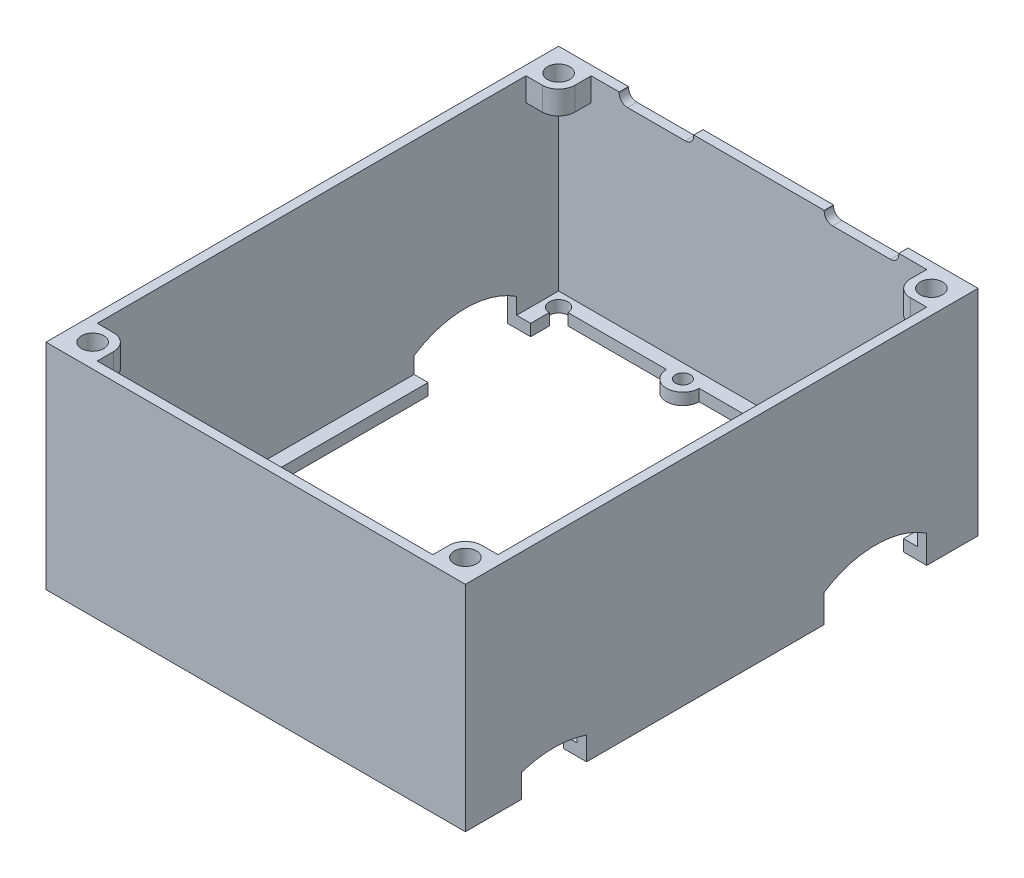
from build123d import *

# Parameters (mm, degrees)
SKETCH1_W               = 90
SKETCH1_H               = 110
BOSS_EXTRUDE1_DEPTH     = 2.5
CUT_EXTRUDE1_DEPTH      = 72.107313267
SKETCH6_R               = 1.6
CUT_EXTRUDE4_DEPTH      = 72.107313267
SKETCH3_W               = 90
SKETCH3_H               = 110
SKETCH3_W_2             = 86
SKETCH3_H_2             = 106
BOSS_EXTRUDE2_DEPTH     = 43.5
SKETCH4_W               = 7
SKETCH4_H               = 7
BOSS_EXTRUDE3_DEPTH     = 5
CUT_EXTRUDE3_REACH      = 86.652
SKETCH5_R               = 2.4
MIRROR2_COPY_1_SKETCH_W = 7
MIRROR2_COPY_1_SKETCH_H = 7
MIRROR2_COPY_1_DEPTH    = 5
MIRROR2_COPY_2_REACH    = 86.652
MIRROR2_COPY_2_SKETCH_R = 2.4
SKETCH8_R               = 3
CUT_EXTRUDE5_DEPTH      = 10
CUT_EXTRUDE6_DEPTH      = 116.06954419
CUT_EXTRUDE7_REACH      = 129.44
SKETCH12_R              = 2
CUT_EXTRUDE8_DEPTH      = 5
CHAMFER1_SIZE           = 0.6
CHAMFER1_SIZE_2         = 1.039230485
FILLET1_R               = 3.5


with BuildPart() as part:
    # Sketch1 → Boss-Extrude1 (new body)
    with BuildSketch(Plane(origin=(0, 0, 0), x_dir=(1, 0, 0), z_dir=(0, 1, 0))):
        Rectangle(SKETCH1_W, SKETCH1_H)
    extrude(amount=BOSS_EXTRUDE1_DEPTH)

    # Sketch2 → Cut-Extrude1 (cut, through all)
    with BuildSketch(Plane(origin=(0, 2.5, 0), x_dir=(1, 0, 0), z_dir=(0, 1, 0))):
        with BuildLine():
            Line((-40, 50), (-16.83333333, 50))
            ThreePointArc((-16.83333333, 50), (-13.33333333, 46.5), (-9.83333333, 50))
            Line((-9.83333333, 50), (23.5, 50))
            ThreePointArc((23.5, 50), (27, 46.5), (30.5, 50))
            Line((30.5, 50), (40, 50))
            Line((40, 50), (40, -50))
            Line((40, -50), (25.6874353, -50))
            ThreePointArc((25.6874353, -50), (22.333333333, -47.5), (18.979231367, -50))
            Line((18.979231367, -50), (-14.8125647, -50))
            ThreePointArc((-14.8125647, -50), (-18.166666667, -47.5), (-21.520768633, -50))
            Line((-21.520768633, -50), (-40, -50))
            Line((-40, -50), (-40, 50))
        make_face()
    extrude(amount=-CUT_EXTRUDE1_DEPTH, mode=Mode.SUBTRACT)

    # Sketch6 → Cut-Extrude4 (cut, through all)
    with BuildSketch(Plane(origin=(0, 2.5, 0), x_dir=(1, 0, 0), z_dir=(0, 1, 0))):
        with Locations(Location((-13.33333333, 50, 0), (0, 0, 270))):
            Circle(SKETCH6_R)
        with Locations(Location((27, 50, 0), (0, 0, 270))):
            Circle(SKETCH6_R)
        with Locations(Location((22.333333333, -51, 0), (0, 0, 270))):
            Circle(SKETCH6_R)
        with Locations(Location((-18.166666667, -51, 0), (0, 0, 270))):
            Circle(SKETCH6_R)
    extrude(amount=-CUT_EXTRUDE4_DEPTH, mode=Mode.SUBTRACT)

    # Sketch3 → Boss-Extrude2 (add)
    with BuildSketch(Plane(origin=(0, 2.5, 0), x_dir=(1, 0, 0), z_dir=(0, 1, 0))):
        Rectangle(SKETCH3_W, SKETCH3_H)
        Rectangle(SKETCH3_W_2, SKETCH3_H_2, mode=Mode.SUBTRACT)
    extrude(amount=BOSS_EXTRUDE2_DEPTH)

    # Sketch4 → Boss-Extrude3 (add)
    with BuildSketch(Plane(origin=(0, 46, 0), x_dir=(1, 0, 0), z_dir=(0, 1, 0))):
        with Locations((-39.5, 49.5)):
            Rectangle(SKETCH4_W, SKETCH4_H)
    boss_extrude3 = extrude(amount=-BOSS_EXTRUDE3_DEPTH)

    # Sketch5 → Cut-Extrude3 (cut, up to next)
    with BuildSketch(Plane(origin=(0, 46, 0), x_dir=(1, 0, 0), z_dir=(0, 1, 0)), mode=Mode.PRIVATE) as cut_extrude3_sk1:
        with Locations(Location((-40, 50, 0), (0, 0, 270))):
            Circle(SKETCH5_R)
    cut_extrude3_tool1 = extrude(cut_extrude3_sk1.sketch, amount=-CUT_EXTRUDE3_REACH, mode=Mode.PRIVATE) & part.part
    cut_extrude3 = cut_extrude3_tool1.solids().sort_by_distance((-40, 46, -50))[0]
    add(cut_extrude3, mode=Mode.SUBTRACT)

    # Mirror1: Boss-Extrude3, Cut-Extrude3 across plane
    add(boss_extrude3.mirror(Plane(origin=(0, 0, 0), x_dir=(0, 0, 1), z_dir=(1, 0, 0))))
    add(cut_extrude3.mirror(Plane(origin=(0, 0, 0), x_dir=(0, 0, 1), z_dir=(1, 0, 0))), mode=Mode.SUBTRACT)

    # Mirror2: Boss-Extrude3, Cut-Extrude3 across plane
    add(boss_extrude3.mirror(Plane.XY))
    add(cut_extrude3.mirror(Plane.XY), mode=Mode.SUBTRACT)

    # Mirror2 copy 1 sketch → Mirror2 copy 1 (add)
    with BuildSketch(Plane(origin=(0, 46, 0), x_dir=(-1, 0, 0), z_dir=(0, 1, 0))):
        with Locations((-39.5, 49.5)):
            Rectangle(MIRROR2_COPY_1_SKETCH_W, MIRROR2_COPY_1_SKETCH_H)
    extrude(amount=-MIRROR2_COPY_1_DEPTH)

    # Mirror2 copy 2 sketch → Mirror2 copy 2 (cut, up to next)
    with BuildSketch(Plane(origin=(0, 46, 0), x_dir=(-1, 0, 0), z_dir=(0, 1, 0)), mode=Mode.PRIVATE) as mirror2_copy_2_sk1:
        with Locations(Location((-40, 50, 0), (0, 0, 270))):
            Circle(MIRROR2_COPY_2_SKETCH_R)
    mirror2_copy_2_tool1 = extrude(mirror2_copy_2_sk1.sketch, amount=-MIRROR2_COPY_2_REACH, mode=Mode.PRIVATE) & part.part
    add(mirror2_copy_2_tool1.solids().sort_by_distance((40, 46, 50))[0], mode=Mode.SUBTRACT)

    # Sketch8 → Cut-Extrude5 (cut)
    with BuildSketch(Plane(origin=(0, 2.5, 0), x_dir=(1, 0, 0), z_dir=(0, 1, 0))):
        with Locations((-18.166666667, -51)):
            Circle(SKETCH8_R)
        with Locations((22.333333333, -51)):
            Circle(SKETCH8_R)
    extrude(amount=CUT_EXTRUDE5_DEPTH, mode=Mode.SUBTRACT)

    # Sketch9 → Cut-Extrude6 (cut, through all)
    with BuildSketch(Plane.ZY.offset(45)):
        with BuildLine():
            Line((-44, 6), (-44, 0))
            Line((-44, 0), (-22, 0))
            Line((-22, 0), (-22, 6))
            ThreePointArc((-22, 6), (-33, 9.296706912), (-44, 6))
        make_face()
        with BuildLine():
            Line((29, 0), (43, 0))
            Line((43, 0), (43, 5))
            ThreePointArc((43, 5), (36, 6.143346385), (29, 5))
            Line((29, 5), (29, 0))
        make_face()
    extrude(amount=-CUT_EXTRUDE6_DEPTH, mode=Mode.SUBTRACT)

    # Sketch10 → Cut-Extrude7 (cut, up to next)
    with BuildSketch(Plane(origin=(0, 0, -55), x_dir=(-1, 0, 0), z_dir=(0, 0, -1)), mode=Mode.PRIVATE) as cut_extrude7_sk1:
        with BuildLine():
            Line((14, 46), (30, 46))
            Line((30, 46), (30, 45.8))
            ThreePointArc((30, 45.8), (29.472792206, 44.527207794), (28.2, 44))
            Line((28.2, 44), (15.8, 44))
            ThreePointArc((15.8, 44), (14.527207794, 44.527207794), (14, 45.8))
            Line((14, 45.8), (14, 46))
        make_face()
    cut_extrude7_tool1 = extrude(cut_extrude7_sk1.sketch, amount=-CUT_EXTRUDE7_REACH, mode=Mode.PRIVATE) & part.part
    # Sketch10 → Cut-Extrude7 (cut, up to next)
    with BuildSketch(Plane(origin=(0, 0, -55), x_dir=(-1, 0, 0), z_dir=(0, 0, -1)), mode=Mode.PRIVATE) as cut_extrude7_sk2:
        with BuildLine():
            Line((-30, 46), (-30, 45.8))
            ThreePointArc((-30, 45.8), (-29.472792206, 44.527207794), (-28.2, 44))
            Line((-28.2, 44), (-15.8, 44))
            ThreePointArc((-15.8, 44), (-14.527207794, 44.527207794), (-14, 45.8))
            Line((-14, 45.8), (-14, 46))
            Line((-14, 46), (-30, 46))
        make_face()
    cut_extrude7_tool2 = extrude(cut_extrude7_sk2.sketch, amount=-CUT_EXTRUDE7_REACH, mode=Mode.PRIVATE) & part.part
    add(cut_extrude7_tool1.solids().sort_by_distance((-22, 45.027165, -55))[0], mode=Mode.SUBTRACT)
    add(cut_extrude7_tool2.solids().sort_by_distance((22, 45.027165, -55))[0], mode=Mode.SUBTRACT)

    # Sketch12 → Cut-Extrude8 (cut)
    with BuildSketch(Plane(origin=(0, 0, 0), x_dir=(1, 0, 0), z_dir=(0, 1, 0))):
        with Locations((-40, -50)):
            Circle(SKETCH12_R)
        with Locations((40, -50)):
            Circle(SKETCH12_R)
        with Locations((-40, 50)):
            Circle(SKETCH12_R)
        with Locations((40, 50)):
            Circle(SKETCH12_R)
    extrude(amount=CUT_EXTRUDE8_DEPTH, mode=Mode.SUBTRACT)

    # Chamfer1
    # the kernel refuses this chamfer: 1.039230485, 0.6 mm, written as the material it takes off along each edge
    with BuildSketch(Plane(origin=(-40, 41, -50), x_dir=(0, 0, 1), z_dir=(-1, 0, 0))) as chamfer1_piece_1_section:
        Polygon((2.4 + CHAMFER1_SIZE, 0), (2.4, CHAMFER1_SIZE_2), (2.4, 0), align=None)
    chamfer1_piece_1 = revolve(axis=Axis((-40, 41, -50), (0, 1, 0)), mode=Mode.PRIVATE)
    chamfer1_piece_1 = split(chamfer1_piece_1, bisect_by=Plane(origin=(-43, 41.510650162, -52.684472026), z_dir=(1, 0, 0)), keep=Keep.TOP, mode=Mode.PRIVATE)
    chamfer1_piece_1 = split(chamfer1_piece_1, bisect_by=Plane(origin=(-40, 41.510650162, -53), z_dir=(0, 0, 1)), keep=Keep.TOP, mode=Mode.PRIVATE)
    add(chamfer1_piece_1, mode=Mode.SUBTRACT)
    with BuildSketch(Plane(origin=(40, 41, -50), x_dir=(0, 0, 1), z_dir=(1, 0, 0))) as chamfer1_piece_2_section:
        Polygon((2.4 + CHAMFER1_SIZE_2, 0), (2.4, -CHAMFER1_SIZE), (2.4, 0), align=None)
    chamfer1_piece_2 = revolve(axis=Axis((40, 41, -50), (0, -1, 0)), mode=Mode.PRIVATE)
    chamfer1_piece_2 = split(chamfer1_piece_2, bisect_by=Plane(origin=(40, 41.284402775, -53), z_dir=(0, 0, 1)), keep=Keep.TOP, mode=Mode.PRIVATE)
    chamfer1_piece_2 = split(chamfer1_piece_2, bisect_by=Plane(origin=(43, 41.284402775, -52.91061018), z_dir=(-1, 0, 0)), keep=Keep.TOP, mode=Mode.PRIVATE)
    add(chamfer1_piece_2, mode=Mode.SUBTRACT)
    with BuildSketch(Plane(origin=(40, 41, 50), x_dir=(0, 0, -1), z_dir=(1, 0, 0))) as chamfer1_piece_3_section:
        Polygon((2.4 + CHAMFER1_SIZE, 0), (2.4, CHAMFER1_SIZE_2), (2.4, 0), align=None)
    chamfer1_piece_3 = revolve(axis=Axis((40, 41, 50), (0, 1, 0)), mode=Mode.PRIVATE)
    chamfer1_piece_3 = split(chamfer1_piece_3, bisect_by=Plane(origin=(43, 41.510650162, 52.684472026), z_dir=(-1, 0, 0)), keep=Keep.TOP, mode=Mode.PRIVATE)
    chamfer1_piece_3 = split(chamfer1_piece_3, bisect_by=Plane(origin=(40, 41.510650162, 53), z_dir=(0, 0, -1)), keep=Keep.TOP, mode=Mode.PRIVATE)
    add(chamfer1_piece_3, mode=Mode.SUBTRACT)
    with BuildSketch(Plane(origin=(-40, 41, 50), x_dir=(0, 0, -1), z_dir=(-1, 0, 0))) as chamfer1_piece_4_section:
        Polygon((2.4 + CHAMFER1_SIZE_2, 0), (2.4, -CHAMFER1_SIZE), (2.4, 0), align=None)
    chamfer1_piece_4 = revolve(axis=Axis((-40, 41, 50), (0, -1, 0)), mode=Mode.PRIVATE)
    chamfer1_piece_4 = split(chamfer1_piece_4, bisect_by=Plane(origin=(-43, 41.284402775, 52.91061018), z_dir=(1, 0, 0)), keep=Keep.TOP, mode=Mode.PRIVATE)
    chamfer1_piece_4 = split(chamfer1_piece_4, bisect_by=Plane(origin=(-40, 41.284402775, 53), z_dir=(0, 0, -1)), keep=Keep.TOP, mode=Mode.PRIVATE)
    add(chamfer1_piece_4, mode=Mode.SUBTRACT)

    # Fillet1
    fillet1_edges = [part.edges().sort_by_distance(p)[0] for p in [
        (36, 43.5, -46),
        (36, 43.5, 46),
        (-36, 43.5, 46),
        (-36, 43.5, -46),
    ]]
    fillet(fillet1_edges, radius=FILLET1_R)


solid = part.part
